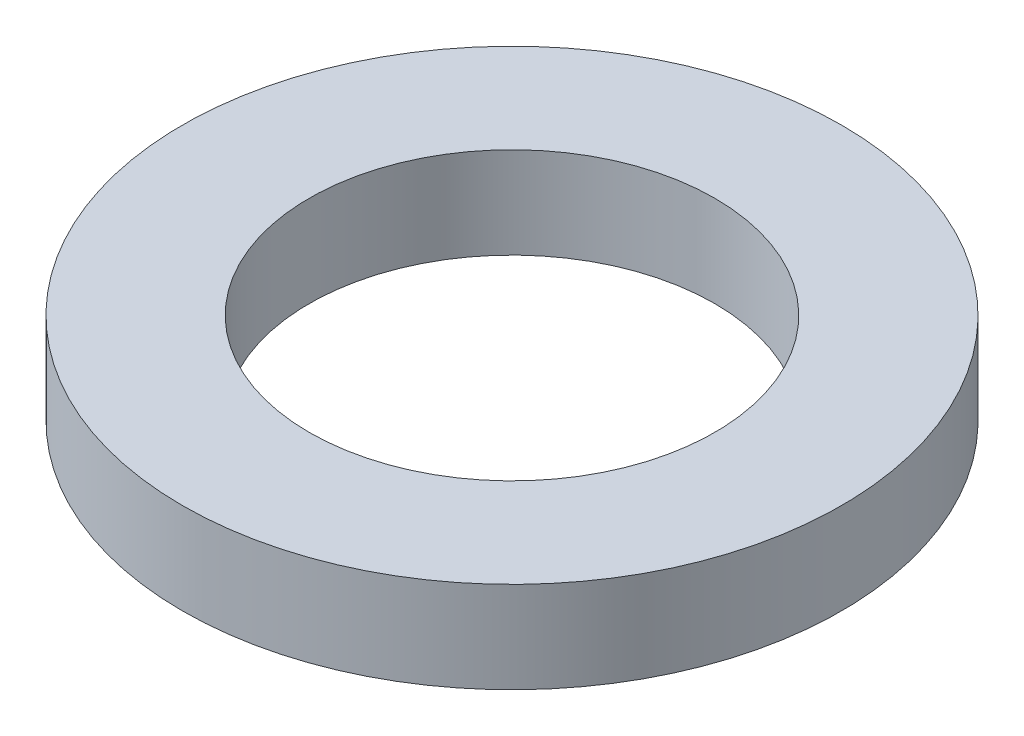
from build123d import *

# Parameters (mm, degrees)
SKETCH1_R           = 32.5
BOSS_EXTRUDE1_DEPTH = 9
SKETCH2_R           = 20
CUT_EXTRUDE1_DEPTH  = 47.834816109


with BuildPart() as part:
    # Sketch1 → Boss-Extrude1 (new body)
    with BuildSketch(Plane(origin=(0, 0, 0), x_dir=(1, 0, 0), z_dir=(0, 1, 0))):
        Circle(SKETCH1_R)
    extrude(amount=BOSS_EXTRUDE1_DEPTH)

    # Sketch2 → Cut-Extrude1 (cut, through all)
    with BuildSketch(Plane(origin=(0, 0, 0), x_dir=(1, 0, 0), z_dir=(0, 1, 0))):
        Circle(SKETCH2_R)
    extrude(amount=CUT_EXTRUDE1_DEPTH, mode=Mode.SUBTRACT)


solid = part.part
